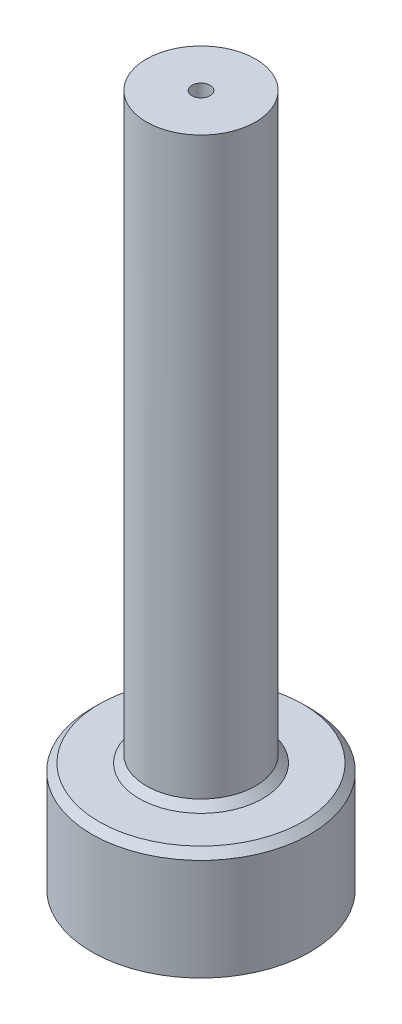
from build123d import *

# Parameters (mm, degrees)
SKETCH2_R           = 15
BOSS_EXTRUDE1_DEPTH = 190
SKETCH3_R           = 30
BOSS_EXTRUDE2_DEPTH = 30
CHAMFER1_SIZE       = 2
CHAMFER2_SIZE       = 2
SKETCH10_R          = 2
SKETCH11_R          = 22.5


with BuildPart() as part:
    # Sketch2 → Boss-Extrude1 (new body)
    with BuildSketch(Plane(origin=(0, 0, 0), x_dir=(1, 0, 0), z_dir=(0, 1, 0))):
        with Locations(Location((0, 0, 0), (0, 0, 270))):
            Circle(SKETCH2_R)
    extrude(amount=BOSS_EXTRUDE1_DEPTH)

    # Sketch3 → Boss-Extrude2 (add)
    with BuildSketch(Plane.XZ):
        with Locations(Location((0, 0, 0), (0, 0, 270))):
            Circle(SKETCH3_R)
    extrude(amount=-BOSS_EXTRUDE2_DEPTH)

    # Chamfer1
    chamfer1_edges = [part.edges().sort_by_distance(p)[0] for p in [
        (0, 30, -15),
    ]]
    chamfer(chamfer1_edges, length=CHAMFER1_SIZE)

    # Chamfer2
    chamfer2_edges = [part.edges().sort_by_distance(p)[0] for p in [
        (0, 30, 30),
    ]]
    chamfer(chamfer2_edges, length=CHAMFER2_SIZE)

    # Cut-Loft1: read off the stored shape, not the designer's step
    # Cut-Loft1: loft between two sections, ruled curve by curve
    cut_loft1_from = [
        Edge.make_bspline([(-0.091086023, 190, 2.498340116), (-5.087766255, 190, 2.316168071), (-4.90559421, 190, -2.680512162), (0.091086023, 190, -2.498340116), (5.087766255, 190, -2.316168071), (4.90559421, 190, 2.680512162), (-0.091086023, 190, 2.498340116)], [0, 0, 0, 0, 0.5, 0.5, 0.5, 1, 1, 1, 1], 3, [1, 0.333333333, 0.333333333, 1, 0.333333333, 0.333333333, 1]),
    ]
    cut_loft1_to = [
        Edge.make_bspline([(-0.443641604, 30, 1.950174897), (-4.343991397, 30, 1.062891688), (-3.456708189, 30, -2.837458105), (0.443641604, 30, -1.950174897), (4.343991397, 30, -1.062891688), (3.456708189, 30, 2.837458105), (-0.443641604, 30, 1.950174897)], [0, 0, 0, 0, 0.5, 0.5, 0.5, 1, 1, 1, 1], 3, [1, 0.333333333, 0.333333333, 1, 0.333333333, 0.333333333, 1]),
    ]
    cut_loft1 = Solid(Shell([*[Face.make_surface_from_curves(cut_loft1_from[k], cut_loft1_to[k]) for k in range(1)], Face(Wire(cut_loft1_from)), Face(Wire(cut_loft1_to))]))
    add(cut_loft1, mode=Mode.SUBTRACT)

    # Sketch10 → Cut-Loft3 section 0
    with BuildSketch(Plane(origin=(0, 30, 0), x_dir=(1, 0, 0), z_dir=(0, 1, 0))):
        Circle(SKETCH10_R)
    # Sketch11 → Cut-Loft3 section 1
    with BuildSketch(Plane.XZ):
        Circle(SKETCH11_R)
    loft(mode=Mode.SUBTRACT)


solid = part.part
